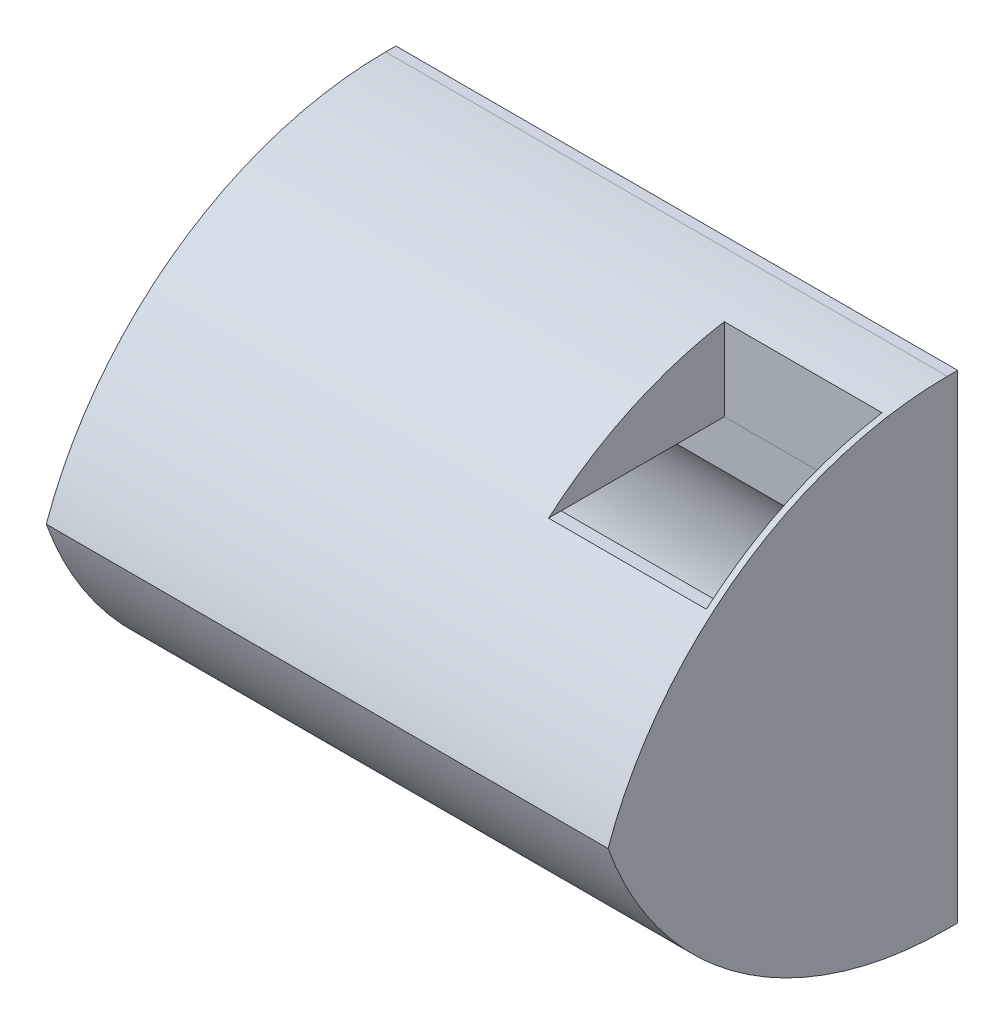
from build123d import *
from build123d.topology import SkipClean

# Parameters (mm, degrees)
CROQUIS1_W              = 38.578820375
CROQUIS1_H              = 46.492266094
SALIENTE_EXTRUIR1_DEPTH = 36
CROQUIS2_R              = 13.723036729
CORTAR_EXTRUIR1_DEPTH   = 54
REDONDEO1_R             = 35
SALIENTE_EXTRUIR2_DEPTH = 16
CROQUIS4_R              = 13.723036729
CORTAR_EXTRUIR2_DEPTH   = 14
CROQUIS5_W              = 15.936830691
CROQUIS5_H              = 4.692990875
CORTAR_EXTRUIR3_DEPTH   = 54
CROQUIS6_W              = 15.323001746
CROQUIS6_H              = 19.007540334
CORTAR_EXTRUIR4_DEPTH   = 54


with BuildPart() as part:
    # Croquis1 → Saliente-Extruir1 (new body)
    with BuildSketch(Plane.XY):
        with Locations((-55.636003999, -7.514612749)):
            Rectangle(CROQUIS1_W, CROQUIS1_H)
    extrude(amount=SALIENTE_EXTRUIR1_DEPTH)

    # Croquis2 → Cortar-Extruir1 (cut)
    with BuildSketch(Plane.ZY.offset(74.925414186)):
        with Locations((15.035056118, -8.31763911)):
            Circle(CROQUIS2_R)
    extrude(amount=-CORTAR_EXTRUIR1_DEPTH, mode=Mode.SUBTRACT)

    # Redondeo1
    # the kernel refuses this fillet: 35 mm, written as the material it takes off along each edge
    with BuildSketch(Plane(origin=(51.153406189, 15.731520298, 36), x_dir=(0, 0, -1), z_dir=(-1, 0, 0))) as redondeo1_piece_1:
        with BuildLine():
            CenterArc((REDONDEO1_R, REDONDEO1_R), REDONDEO1_R, 180, 90)
            Line((0, REDONDEO1_R), (0, 0))
            Line((0, 0), (REDONDEO1_R, 0))
        make_face()
    extrude(amount=213.578820376, mode=Mode.SUBTRACT)
    with BuildSketch(Plane(origin=(-162.425414186, -30.760745796, 36), x_dir=(0, 1, 0), z_dir=(1, 0, 0))) as redondeo1_piece_2:
        with BuildLine():
            CenterArc((REDONDEO1_R, -REDONDEO1_R), REDONDEO1_R, 90, 90)
            Line((0, -REDONDEO1_R), (0, 0))
            Line((0, 0), (REDONDEO1_R, 0))
        make_face()
    extrude(amount=213.578820376, mode=Mode.SUBTRACT)

    # Croquis3 → Saliente-Extruir2 (add)
    with BuildSketch(Plane(origin=(-36.346593811, 0, 0), x_dir=(0, 0, -1), z_dir=(1, 0, 0))):
        with BuildLine():
            Line((0, 15.731520298), (-1, 15.731520298))
            ThreePointArc((-1, 15.731520298), (-21.169465246, 9.335587695), (-33.967356759, -7.514612749))
            ThreePointArc((-33.967356759, -7.514612749), (-21.169465246, -24.364813193), (-1, -30.760745796))
            Line((-1, -30.760745796), (0, -30.760745796))
            Line((0, -30.760745796), (0, 15.731520298))
        make_face()
    extrude(amount=SALIENTE_EXTRUIR2_DEPTH)

    # Croquis4 → Cortar-Extruir2 (cut)
    with SkipClean():  # the faces are left unmerged after this step: merging them gives an invalid solid
        with BuildSketch(Plane.ZY.offset(36.346593811)):
            with Locations((15.035056118, -8.31763911)):
                Circle(CROQUIS4_R)
        extrude(amount=-CORTAR_EXTRUIR2_DEPTH, mode=Mode.SUBTRACT)

    # Croquis5 → Cortar-Extruir3 (cut)
    with SkipClean():  # the faces are left unmerged after this step: merging them gives an invalid solid
        with BuildSketch(Plane.ZY.offset(74.925414186)):
            with Locations((14.642217913, 4.910546276)):
                Rectangle(CROQUIS5_W, CROQUIS5_H)
        extrude(amount=-CORTAR_EXTRUIR3_DEPTH, mode=Mode.SUBTRACT)

    # Croquis6 → Cortar-Extruir4 (cut)
    with SkipClean():  # the faces are left unmerged after this step: merging them gives an invalid solid
        with BuildSketch(Plane.XZ.offset(-7.257041714)):
            with Locations((-28.598941082, 16.267176719)):
                Rectangle(CROQUIS6_W, CROQUIS6_H)
        extrude(amount=-CORTAR_EXTRUIR4_DEPTH, mode=Mode.SUBTRACT)


solid = part.part
